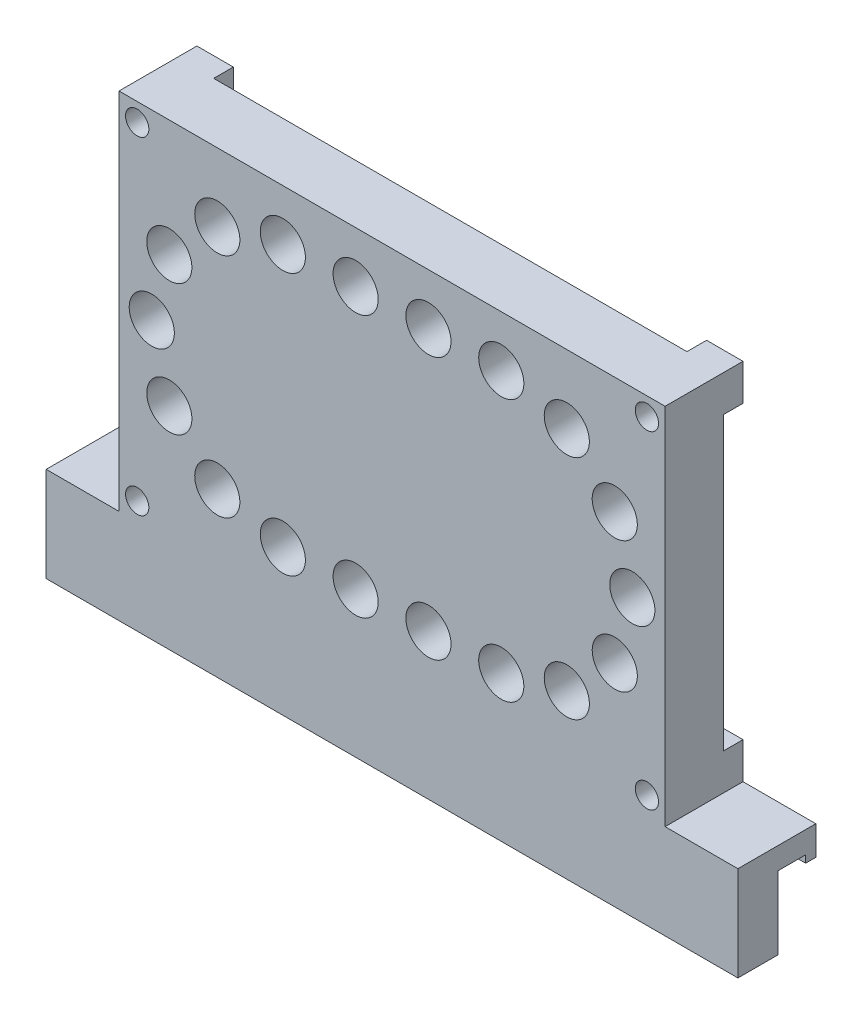
from build123d import *

# Parameters (mm, degrees)
ESQUISSE1_W                  = 75
ESQUISSE1_H                  = 50
MAIN_EXTRUSION_DEPTH         = 8
DOUBLE_CIRCLE_DEPTH          = 6
ESQUISSE3_W                  = 5
ESQUISSE3_H                  = 5
FIXING_SUPPORT_DEPTH         = 2.7
ESQUISSE4_R                  = 1.6
FIXING_HOLE_DEPTH            = 47.322132939
ESQUISSE5_R                  = 3.1
GEAR_LINEAR_HOLES_DEPTH      = 46.773900861
R_P_TITION_LIN_AIRE1_COUNT   = 3
R_P_TITION_LIN_AIRE1_PITCH   = 10
ESQUISSE6_R                  = 3.1
GEAR_CIRCLE_DEPTH            = 46.773900861
R_P_TITION_CIRCULAIRE1_COUNT = 7
R_P_TITION_CIRCULAIRE1_ANGLE = 180
SYM_TRIE2_COPY_1_SKETCH_R    = 3.1
SYM_TRIE2_COPY_1_DEPTH       = 46.773900861
SYM_TRIE2_COPY_2_SKETCH_R    = 3.1
SYM_TRIE2_COPY_2_DEPTH       = 46.773900861
SYM_TRIE2_COPY_3_SKETCH_R    = 3.1
SYM_TRIE2_COPY_3_DEPTH       = 46.773900861
SYM_TRIE2_COPY_4_SKETCH_R    = 3.1
SYM_TRIE2_COPY_4_DEPTH       = 46.773900861
SYM_TRIE2_COPY_5_SKETCH_R    = 3.1
SYM_TRIE2_COPY_5_DEPTH       = 46.773900861
SYM_TRIE2_COPY_6_SKETCH_R    = 3.1
SYM_TRIE2_COPY_6_DEPTH       = 46.773900861
SYM_TRIE2_COPY_7_SKETCH_R    = 3.1
SYM_TRIE2_COPY_7_DEPTH       = 46.773900861
SYM_TRIE3_COPY_1_SKETCH_R    = 3.1
SYM_TRIE3_COPY_1_DEPTH       = 46.773900861
SYM_TRIE3_COPY_2_SKETCH_R    = 3.1
SYM_TRIE3_COPY_2_DEPTH       = 46.773900861
SYM_TRIE3_COPY_3_SKETCH_R    = 3.1
SYM_TRIE3_COPY_3_DEPTH       = 46.773900861
BOSS_EXTRU_1_DEPTH           = 47.5
ENL_V_MAT_EXTRU_1_DEPTH      = 96.535124431
ENL_V_MAT_EXTRU_1_DEPTH_BACK = 96.535124431
ESQUISSE7_W                  = 40
ESQUISSE7_H                  = 100


with BuildPart() as part:
    # Esquisse1 → Main Extrusion (new body)
    with BuildSketch(Plane.XY):
        Rectangle(ESQUISSE1_W, ESQUISSE1_H)
    extrude(amount=MAIN_EXTRUSION_DEPTH)

    # Esquisse2 → Double Circle (cut)
    with BuildSketch(Plane.XY.offset(8)):
        with BuildLine():
            Line((-15, -8.2), (15, -8.2))
            ThreePointArc((15, -8.2), (23.2, 0), (15, 8.2))
            Line((15, 8.2), (-15, 8.2))
            ThreePointArc((-15, 8.2), (-23.2, 0), (-15, -8.2))
        make_face()
        with BuildLine():
            Line((-15, 2), (15, 2))
            ThreePointArc((15, 2), (17, 0), (15, -2))
            Line((15, -2), (-15, -2))
            ThreePointArc((-15, -2), (-17, 0), (-15, 2))
        make_face(mode=Mode.SUBTRACT)
    extrude(amount=-DOUBLE_CIRCLE_DEPTH, mode=Mode.SUBTRACT)

    # Esquisse3 → Fixing Support (add)
    with BuildSketch(Plane.XY.offset(8)):
        with Locations((-35, -22.5)):
            Rectangle(ESQUISSE3_W, ESQUISSE3_H)
        with Locations((-35, 22.5)):
            Rectangle(ESQUISSE3_W, ESQUISSE3_H)
        with Locations((35, 22.5)):
            Rectangle(ESQUISSE3_W, ESQUISSE3_H)
        with Locations((35, -22.5)):
            Rectangle(ESQUISSE3_W, ESQUISSE3_H)
    extrude(amount=FIXING_SUPPORT_DEPTH)

    # Esquisse4 → Fixing Hole (cut, through all)
    with BuildSketch(Plane.XY.offset(10.7)):
        with Locations((-35, -22.5)):
            Circle(ESQUISSE4_R)
        with Locations((35, 22.5)):
            Circle(ESQUISSE4_R)
        with Locations((-35, 22.5)):
            Circle(ESQUISSE4_R)
        with Locations((35, -22.5)):
            Circle(ESQUISSE4_R)
    extrude(amount=-FIXING_HOLE_DEPTH, mode=Mode.SUBTRACT)

    # Esquisse5 → Gear Linear Holes (cut, through all)
    with BuildSketch(Plane.XY.offset(8)):
        with Locations((-15, -18)):
            Circle(ESQUISSE5_R)
    gear_linear_holes = extrude(amount=-GEAR_LINEAR_HOLES_DEPTH, mode=Mode.SUBTRACT)

    # Répétition linéaire1: Gear Linear Holes ×3
    with Locations(*[(i * R_P_TITION_LIN_AIRE1_PITCH, 0, 0) for i in range(1, R_P_TITION_LIN_AIRE1_COUNT)]):
        add(gear_linear_holes, mode=Mode.SUBTRACT)

    # Esquisse6 → Gear Circle (cut, through all)
    with BuildSketch(Plane.XY.offset(8)):
        with Locations((15, -18)):
            Circle(ESQUISSE6_R)
    gear_circle = extrude(amount=-GEAR_CIRCLE_DEPTH, mode=Mode.SUBTRACT)

    # Répétition circulaire1: Gear Circle ×7 about axis
    r_p_tition_circulaire1_axis = Axis((15, 0, -0.535), (0, 0, 1))
    for i in range(1, R_P_TITION_CIRCULAIRE1_COUNT):
        add(gear_circle.rotate(r_p_tition_circulaire1_axis, i * R_P_TITION_CIRCULAIRE1_ANGLE / (R_P_TITION_CIRCULAIRE1_COUNT - 1)), mode=Mode.SUBTRACT)

    # Symétrie2 copy 1 sketch → Symétrie2 copy 1 (cut, through all)
    with BuildSketch(Plane(origin=(-2.009618943, -7.5, 8), x_dir=(-0.866025403784438, 0.5000000000000011, 0), z_dir=(0, 0, 1))):
        with Locations((15, 18)):
            Circle(SYM_TRIE2_COPY_1_SKETCH_R)
    extrude(amount=-SYM_TRIE2_COPY_1_DEPTH, mode=Mode.SUBTRACT)

    # Symétrie2 copy 2 sketch → Symétrie2 copy 2 (cut, through all)
    with BuildSketch(Plane(origin=(-7.5, -12.990381057, 8), x_dir=(-0.4999999999999978, 0.8660254037844399, 0), z_dir=(0, 0, 1))):
        with Locations((15, 18)):
            Circle(SYM_TRIE2_COPY_2_SKETCH_R)
    extrude(amount=-SYM_TRIE2_COPY_2_DEPTH, mode=Mode.SUBTRACT)

    # Symétrie2 copy 3 sketch → Symétrie2 copy 3 (cut, through all)
    with BuildSketch(Plane(origin=(-15, -15, 8), x_dir=(0, 1, 0), z_dir=(0, 0, 1))):
        with Locations((15, 18)):
            Circle(SYM_TRIE2_COPY_3_SKETCH_R)
    extrude(amount=-SYM_TRIE2_COPY_3_DEPTH, mode=Mode.SUBTRACT)

    # Symétrie2 copy 4 sketch → Symétrie2 copy 4 (cut, through all)
    with BuildSketch(Plane(origin=(-22.5, -12.990381057, 8), x_dir=(0.5000000000000044, 0.866025403784436, 0), z_dir=(0, 0, 1))):
        with Locations((15, 18)):
            Circle(SYM_TRIE2_COPY_4_SKETCH_R)
    extrude(amount=-SYM_TRIE2_COPY_4_DEPTH, mode=Mode.SUBTRACT)

    # Symétrie2 copy 5 sketch → Symétrie2 copy 5 (cut, through all)
    with BuildSketch(Plane(origin=(-27.990381057, -7.5, 8), x_dir=(0.8660254037844416, 0.49999999999999495, 0), z_dir=(0, 0, 1))):
        with Locations((15, 18)):
            Circle(SYM_TRIE2_COPY_5_SKETCH_R)
    extrude(amount=-SYM_TRIE2_COPY_5_DEPTH, mode=Mode.SUBTRACT)

    # Symétrie2 copy 6 sketch → Symétrie2 copy 6 (cut, through all)
    with BuildSketch(Plane(origin=(-30, 0, 8), x_dir=(1, 0, 0), z_dir=(0, 0, 1))):
        with Locations((15, 18)):
            Circle(SYM_TRIE2_COPY_6_SKETCH_R)
    extrude(amount=-SYM_TRIE2_COPY_6_DEPTH, mode=Mode.SUBTRACT)

    # Symétrie2 copy 7 sketch → Symétrie2 copy 7 (cut, through all)
    with BuildSketch(Plane(origin=(0, 0, 8), x_dir=(-1, 0, 0), z_dir=(0, 0, 1))):
        with Locations((15, 18)):
            Circle(SYM_TRIE2_COPY_7_SKETCH_R)
    extrude(amount=-SYM_TRIE2_COPY_7_DEPTH, mode=Mode.SUBTRACT)

    # Symétrie3 copy 1 sketch → Symétrie3 copy 1 (cut, through all)
    with BuildSketch(Plane(origin=(10, 0, 8), x_dir=(1, 0, 0), z_dir=(0, 0, 1))):
        with Locations((-15, 18)):
            Circle(SYM_TRIE3_COPY_1_SKETCH_R)
    extrude(amount=-SYM_TRIE3_COPY_1_DEPTH, mode=Mode.SUBTRACT)

    # Symétrie3 copy 2 sketch → Symétrie3 copy 2 (cut, through all)
    with BuildSketch(Plane(origin=(20, 0, 8), x_dir=(1, 0, 0), z_dir=(0, 0, 1))):
        with Locations((-15, 18)):
            Circle(SYM_TRIE3_COPY_2_SKETCH_R)
    extrude(amount=-SYM_TRIE3_COPY_2_DEPTH, mode=Mode.SUBTRACT)

    # Symétrie3 copy 3 sketch → Symétrie3 copy 3 (cut, through all)
    with BuildSketch(Plane.XY.offset(8)):
        with Locations((-15, 18)):
            Circle(SYM_TRIE3_COPY_3_SKETCH_R)
    extrude(amount=-SYM_TRIE3_COPY_3_DEPTH, mode=Mode.SUBTRACT)

    # Esquisse8 → Boss.-Extru.1 (add, symmetric)
    with BuildSketch(Plane(origin=(0, 0, 0), x_dir=(0, 0, -1), z_dir=(1, 0, 0))):
        Polygon((-5.5, -28), (-5.5, -38), (0, -38), (0, -25), (-10.7, -25), (-10.7, -29), (-9.3, -29), (-9.3, -28), align=None)
    extrude(amount=BOSS_EXTRU_1_DEPTH, both=True)


with BuildPart() as body_2:
    # Symétrie4: mirrored copy
    add(part.part.mirror(Plane.XY.offset(10.7)))


with BuildPart() as part_1:
    add(part.part)

    # Esquisse7 → Enlèv. mat.-Extru.1 (cut, two sides: drawn at the far end of the back side and taken through both)
    with BuildSketch(Plane.ZY.offset(37.5).offset(-ENL_V_MAT_EXTRU_1_DEPTH_BACK)):
        with Locations((-9.3, -5)):
            Rectangle(ESQUISSE7_W, ESQUISSE7_H)
    extrude(amount=ENL_V_MAT_EXTRU_1_DEPTH + ENL_V_MAT_EXTRU_1_DEPTH_BACK, mode=Mode.SUBTRACT)


solid = body_2.part
